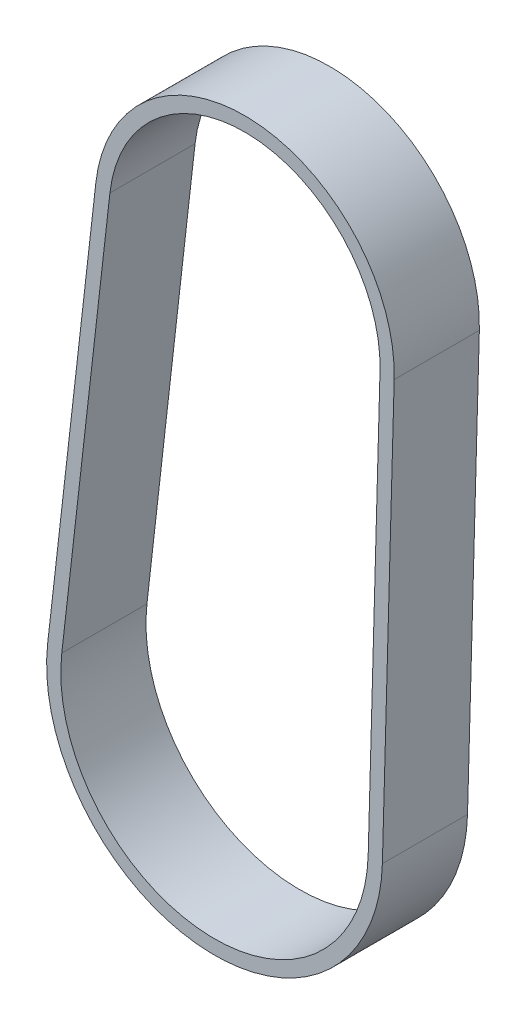
from build123d import *

# Parameters (mm, degrees)
EXTRUDE_THIN1_DEPTH = 9


with BuildPart() as part:
    # Sketch2 → Extrude-Thin1 (new body)
    with BuildSketch(Plane.XY):
        with BuildLine():
            Line((15.817830617, -0.439847777), (14.568141525, -45.381237528))
            ThreePointArc((14.568141525, -45.381237528), (-4.427361135, -62.593616825), (-20.810936342, -42.878810567))
            Line((-20.810936342, -42.878810567), (-15.722258285, 1.791040465))
            ThreePointArc((-15.722258285, 1.791040465), (1.116467243, 15.784509255), (15.817830617, -0.439847777))
        make_face()
        with BuildLine():
            Line((14.318410207, -0.398153265), (13.068721115, -45.339543015))
            ThreePointArc((13.068721115, -45.339543015), (-4.321527799, -61.097355048), (-19.320575524, -43.048588755))
            Line((-19.320575524, -43.048588755), (-14.231897467, 1.621262276))
            ThreePointArc((-14.231897467, 1.621262276), (1.010633908, 14.288247478), (14.318410207, -0.398153265))
        make_face(mode=Mode.SUBTRACT)
    extrude(amount=EXTRUDE_THIN1_DEPTH)


solid = part.part
